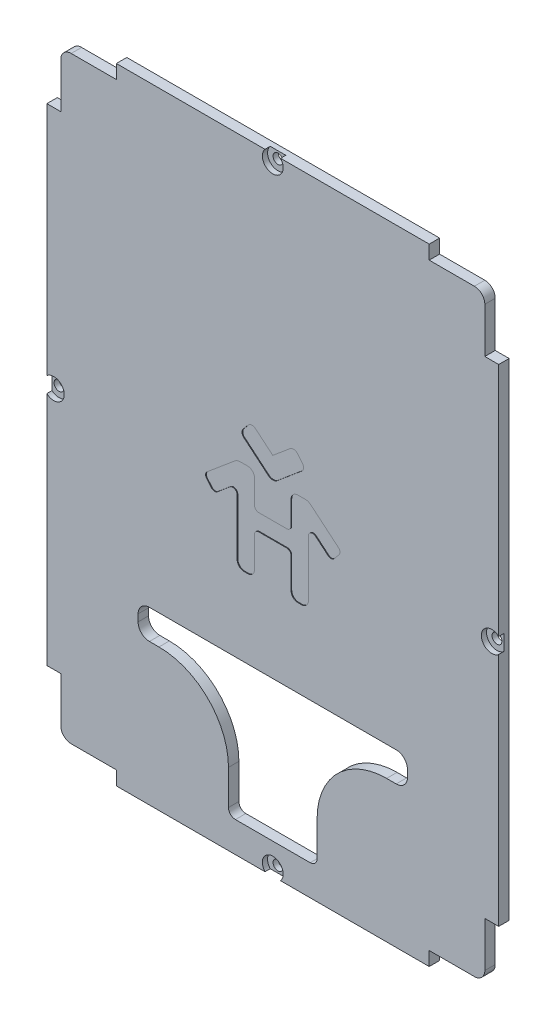
from build123d import *

# Parameters (mm, degrees)
EXTRUDE_1_DEPTH     = 3
CUT_EXTRUDE_1_DEPTH = 10
SKETCH_3_R          = 3
CUT_EXTRUDE_2_DEPTH = 1.5
SKETCH_4_R          = 1.425
CUT_EXTRUDE_3_DEPTH = 2
CUT_EXTRUDE_4_DEPTH = 0.2
CUT_EXTRUDE_START   = -10
CUT_EXTRUDE_5_DEPTH = 10


with BuildPart() as part:
    # Эскиз1 → Бобышка-Вытянуть1 (new body)
    with BuildSketch(Plane.XY):
        with BuildLine():
            Line((-55, -90), (55, -90))
            ThreePointArc((55, -90), (62.071067812, -87.071067812), (65, -80))
            Line((65, -80), (65, 80))
            ThreePointArc((65, 80), (62.071067812, 87.071067812), (55, 90))
            Line((55, 90), (-55, 90))
            ThreePointArc((-55, 90), (-62.071067812, 87.071067812), (-65, 80))
            Line((-65, 80), (-65, -80))
            ThreePointArc((-65, -80), (-62.071067812, -87.071067812), (-55, -90))
        make_face()
    extrude(amount=EXTRUDE_1_DEPTH)

    # Эскиз2 → Вырез-Вытянуть1 (cut)
    with BuildSketch(Plane(origin=(0, 0, 0), x_dir=(-1, 0, 0), z_dir=(0, 0, -1))):
        with BuildLine():
            Line((-38.75, -44), (-38.75, -46))
            ThreePointArc((-38.75, -46), (-37.798097039, -48.298097039), (-35.5, -49.25))
            Line((-35.5, -49.25), (-32.75, -49.25))
            ThreePointArc((-32.75, -49.25), (-18.607864376, -55.107864376), (-12.75, -69.25))
            Line((-12.75, -69.25), (-12.75, -79.25))
            ThreePointArc((-12.75, -79.25), (-12.164213562, -80.664213562), (-10.75, -81.25))
            Line((-10.75, -81.25), (10.75, -81.25))
            ThreePointArc((10.75, -81.25), (12.164213562, -80.664213562), (12.75, -79.25))
            Line((12.75, -79.25), (12.75, -69.25))
            ThreePointArc((12.75, -69.25), (18.607864376, -55.107864376), (32.75, -49.25))
            Line((32.75, -49.25), (35.5, -49.25))
            ThreePointArc((35.5, -49.25), (37.798097039, -48.298097039), (38.75, -46))
            Line((38.75, -46), (38.75, -44))
            ThreePointArc((38.75, -44), (37.798097039, -41.701902961), (35.5, -40.75))
            Line((35.5, -40.75), (-35.5, -40.75))
            ThreePointArc((-35.5, -40.75), (-37.798097039, -41.701902961), (-38.75, -44))
        make_face()
    extrude(amount=-CUT_EXTRUDE_1_DEPTH, mode=Mode.SUBTRACT)

    # Эскиз3 → Вырез-Вытянуть2 (cut)
    with BuildSketch(Plane.XY.offset(3)):
        with Locations((0, 88)):
            Circle(SKETCH_3_R)
        with Locations((63, 0)):
            Circle(SKETCH_3_R)
        with Locations((0, -88)):
            Circle(SKETCH_3_R)
        with Locations((-63, 0)):
            Circle(SKETCH_3_R)
    extrude(amount=-CUT_EXTRUDE_2_DEPTH, mode=Mode.SUBTRACT)

    # Эскиз4 → Вырез-Вытянуть3 (cut)
    with BuildSketch(Plane.XY.offset(1.5)):
        with Locations((0, 88)):
            Circle(SKETCH_4_R)
        with Locations((63, 0)):
            Circle(SKETCH_4_R)
        with Locations((0, -88)):
            Circle(SKETCH_4_R)
        with Locations((-63, 0)):
            Circle(SKETCH_4_R)
    extrude(amount=-CUT_EXTRUDE_3_DEPTH, mode=Mode.SUBTRACT)

    # Эскиз5 → Вырез-Вытянуть4 (cut)
    with BuildSketch(Plane.XY.offset(3)):
        with BuildLine():
            Line((-10.25, -0.09106889), (-10.25, -16.21851864))
            ThreePointArc((-10.25, -16.21851864), (-9.664213562, -17.632732202), (-8.25, -18.21851864))
            Line((-8.25, -18.21851864), (-7.25, -18.21851864))
            ThreePointArc((-7.25, -18.21851864), (-5.835786438, -17.632732202), (-5.25, -16.21851864))
            Line((-5.25, -16.21851864), (-5.25, -7.46851864))
            ThreePointArc((-5.25, -7.46851864), (-4.883883476, -6.584635164), (-4, -6.21851864))
            Line((-4, -6.21851864), (4, -6.21851864))
            ThreePointArc((4, -6.21851864), (4.883883476, -6.584635164), (5.25, -7.46851864))
            Line((5.25, -7.46851864), (5.25, -16.21851864))
            ThreePointArc((5.25, -16.21851864), (5.835786438, -17.632732202), (7.25, -18.21851864))
            Line((7.25, -18.21851864), (8.25, -18.21851864))
            ThreePointArc((8.25, -18.21851864), (9.664213562, -17.632732202), (10.25, -16.21851864))
            Line((10.25, -16.21851864), (10.25, -0.09106889))
            ThreePointArc((10.25, -0.09106889), (10.971727173, 1.041815844), (12.303484512, 0.866486664))
            Line((12.303484512, 0.866486664), (15.917557024, -2.166080248))
            ThreePointArc((15.917557024, -2.166080248), (16.829986215, -2.453768066), (17.67859709, -2.012009206))
            Line((17.67859709, -2.012009206), (19.022071027, -0.410919315))
            ThreePointArc((19.022071027, -0.410919315), (19.309758846, 0.501509876), (18.867999985, 1.350120751))
            Line((18.867999985, 1.350120751), (10.947043439, 7.996592468))
            ThreePointArc((10.947043439, 7.996592468), (10.195124773, 8.430712912), (9.340074414, 8.58148136))
            Line((9.340074414, 8.58148136), (7.25, 8.58148136))
            ThreePointArc((7.25, 8.58148136), (5.835786438, 7.995694922), (5.25, 6.58148136))
            Line((5.25, 6.58148136), (5.25, -0.16851864))
            ThreePointArc((5.25, -0.16851864), (4.883883476, -1.052402116), (4, -1.41851864))
            Line((4, -1.41851864), (-4, -1.41851864))
            ThreePointArc((-4, -1.41851864), (-4.883883476, -1.052402116), (-5.25, -0.16851864))
            Line((-5.25, -0.16851864), (-5.25, 6.58148136))
            ThreePointArc((-5.25, 6.58148136), (-5.835786438, 7.995694922), (-7.25, 8.58148136))
            Line((-7.25, 8.58148136), (-9.340074414, 8.58148136))
            ThreePointArc((-9.340074414, 8.58148136), (-10.195124773, 8.430712912), (-10.947043439, 7.996592468))
            Line((-10.947043439, 7.996592468), (-18.867999985, 1.350120751))
            ThreePointArc((-18.867999985, 1.350120751), (-19.309758846, 0.501509876), (-19.022071027, -0.410919315))
            Line((-19.022071027, -0.410919315), (-17.67859709, -2.012009206))
            ThreePointArc((-17.67859709, -2.012009206), (-16.829986215, -2.453768066), (-15.917557024, -2.166080248))
            Line((-15.917557024, -2.166080248), (-12.303484512, 0.866486664))
            ThreePointArc((-12.303484512, 0.866486664), (-10.971727173, 1.041815844), (-10.25, -0.09106889))
        make_face()
        with BuildLine():
            Line((0, 14.858517807), (-4.979473915, 19.036792532))
            ThreePointArc((-4.979473915, 19.036792532), (-6.074388944, 19.382017915), (-7.092721994, 18.851907282))
            Line((-7.092721994, 18.851907282), (-8.483871936, 17.193999341))
            ThreePointArc((-8.483871936, 17.193999341), (-8.829097318, 16.099084312), (-8.298986686, 15.080751262))
            Line((-8.298986686, 15.080751262), (-1.285575219, 9.195800287))
            ThreePointArc((-1.285575219, 9.195800287), (0, 8.727889173), (1.285575219, 9.195800287))
            Line((1.285575219, 9.195800287), (8.298986686, 15.080751262))
            ThreePointArc((8.298986686, 15.080751262), (8.829097318, 16.099084312), (8.483871936, 17.193999341))
            Line((8.483871936, 17.193999341), (7.092721994, 18.851907282))
            ThreePointArc((7.092721994, 18.851907282), (6.074388944, 19.382017915), (4.979473915, 19.036792532))
            Line((4.979473915, 19.036792532), (0, 14.858517807))
        make_face()
    extrude(amount=-CUT_EXTRUDE_4_DEPTH, mode=Mode.SUBTRACT)

    # Эскиз8 → Вырез-Вытянуть5 (cut)
    with BuildSketch(Plane.XY.offset(3).offset(CUT_EXTRUDE_START)):
        with BuildLine():
            Line((-55, 90), (-45, 90))
            Line((-45, 90), (-45, 86))
            Line((-45, 86), (-58, 86))
            ThreePointArc((-58, 86), (-60.121320344, 85.121320344), (-61, 83))
            Line((-61, 83), (-61, 70))
            Line((-61, 70), (-65, 70))
            Line((-65, 70), (-65, 80))
            ThreePointArc((-65, 80), (-62.071067812, 87.071067812), (-55, 90))
        make_face()
        with BuildLine():
            Line((65, 70), (65, 80))
            ThreePointArc((65, 80), (62.071067812, 87.071067812), (55, 90))
            Line((55, 90), (45, 90))
            Line((45, 90), (45, 86))
            Line((45, 86), (58, 86))
            ThreePointArc((58, 86), (60.121320344, 85.121320344), (61, 83))
            Line((61, 83), (61, 70))
            Line((61, 70), (65, 70))
        make_face()
        with BuildLine():
            Line((55, -90), (45, -90))
            Line((45, -90), (45, -86))
            Line((45, -86), (58, -86))
            ThreePointArc((58, -86), (60.121320344, -85.121320344), (61, -83))
            Line((61, -83), (61, -70))
            Line((61, -70), (65, -70))
            Line((65, -70), (65, -80))
            ThreePointArc((65, -80), (62.071067812, -87.071067812), (55, -90))
        make_face()
        with BuildLine():
            Line((-65, -70), (-65, -80))
            ThreePointArc((-65, -80), (-62.071067812, -87.071067812), (-55, -90))
            Line((-55, -90), (-45, -90))
            Line((-45, -90), (-45, -86))
            Line((-45, -86), (-58, -86))
            ThreePointArc((-58, -86), (-60.121320344, -85.121320344), (-61, -83))
            Line((-61, -83), (-61, -70))
            Line((-61, -70), (-65, -70))
        make_face()
    extrude(amount=CUT_EXTRUDE_5_DEPTH, mode=Mode.SUBTRACT)


solid = part.part
